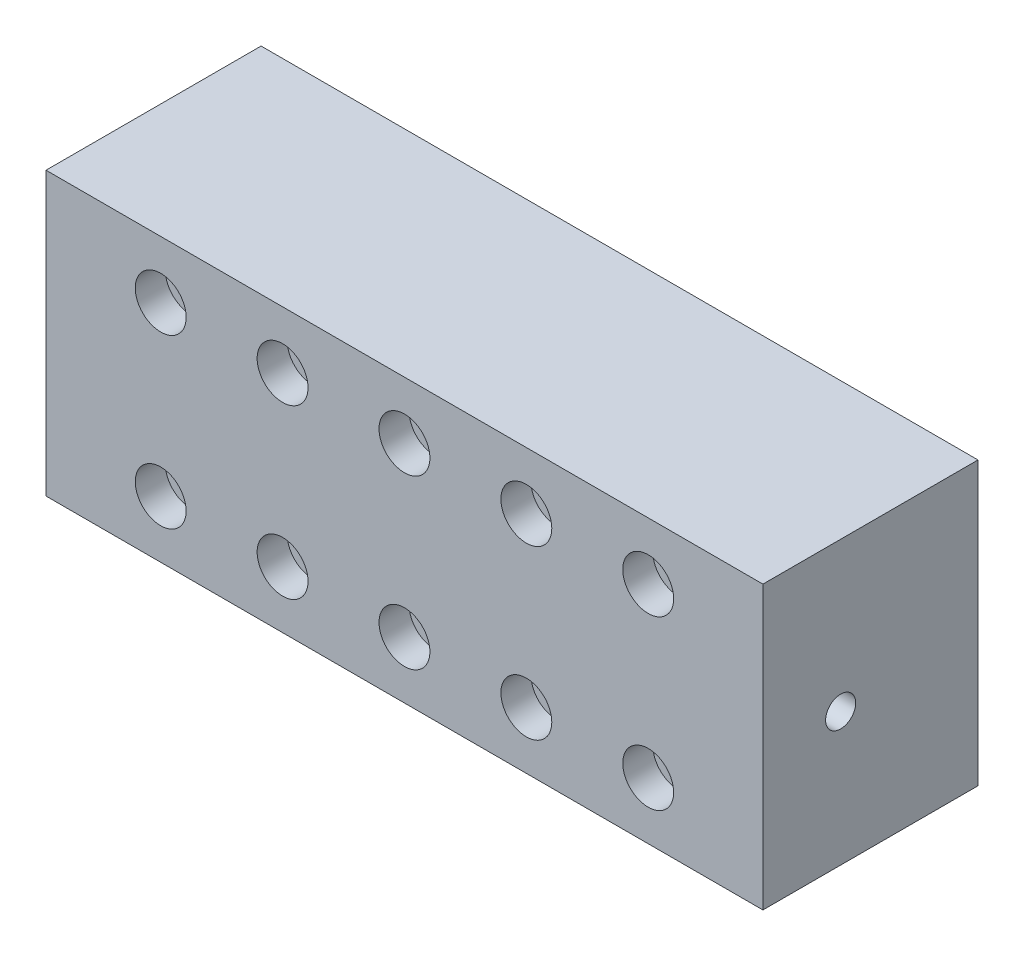
from build123d import *

# Parameters (mm, degrees)
SKIZZE2_W                            = 100
SKIZZE2_H                            = 39.364160046
AUFSATZ_LINEAR_AUSTRAGEN1_DEPTH      = 30
SCHNITT_LINEAR_AUSTRAGEN1_DEPTH      = 40
SCHNITT_LINEAR_AUSTRAGEN1_DEPTH_BACK = 40
SKIZZE10_R                           = 5
SKIZZE17_R                           = 1.55
SCHNITT_LINEAR_AUSTRAGEN2_DEPTH      = 9.1
SKIZZE24_R                           = 2
SCHNITT_LINEAR_AUSTRAGEN4_DEPTH      = 112.577493681
SKIZZE41_R                           = 3.55
SCHNITT_LINEAR_AUSTRAGEN11_DEPTH     = 4.2
LINEARES_MUSTER5_COUNT               = 5
LINEARES_MUSTER5_PITCH               = 17
SPIEGELN9_COPY_1_SKETCH_R            = 3.55
SPIEGELN9_COPY_1_DEPTH               = 4.2
SPIEGELN9_COPY_2_SKETCH_R            = 3.55
SPIEGELN9_COPY_2_DEPTH               = 4.2
SPIEGELN9_COPY_3_SKETCH_R            = 3.55
SPIEGELN9_COPY_3_DEPTH               = 4.2
SPIEGELN9_COPY_4_SKETCH_R            = 3.55
SPIEGELN9_COPY_4_DEPTH               = 4.2
SPIEGELN9_COPY_5_SKETCH_R            = 3.55
SPIEGELN9_COPY_5_DEPTH               = 4.2
SKIZZE28_W                           = 7.1
SKIZZE28_H                           = 3.3
SCHNITT_LINEAR_AUSTRAGEN5_DEPTH      = 7.96
SCHNITT_LINEAR_AUSTRAGEN8_DEPTH      = 1.65
LINEARES_MUSTER3_COUNT               = 5
LINEARES_MUSTER3_PITCH               = 17
LINEARES_MUSTER4_COUNT               = 5
LINEARES_MUSTER4_PITCH               = 17
SPIEGELN7_COPY_1_DEPTH               = 1.65
SPIEGELN7_COPY_2_DEPTH               = 1.65
SPIEGELN7_COPY_3_DEPTH               = 1.65
SPIEGELN7_COPY_4_DEPTH               = 1.65
SPIEGELN7_COPY_5_DEPTH               = 1.65
SPIEGELN8_COPY_1_SKETCH_W            = 7.1
SPIEGELN8_COPY_1_SKETCH_H            = 3.3
SPIEGELN8_COPY_1_DEPTH               = 7.96
SPIEGELN8_COPY_2_SKETCH_W            = 7.1
SPIEGELN8_COPY_2_SKETCH_H            = 3.3
SPIEGELN8_COPY_2_DEPTH               = 7.96
SPIEGELN8_COPY_3_SKETCH_W            = 7.1
SPIEGELN8_COPY_3_SKETCH_H            = 3.3
SPIEGELN8_COPY_3_DEPTH               = 7.96
SPIEGELN8_COPY_4_SKETCH_W            = 7.1
SPIEGELN8_COPY_4_SKETCH_H            = 3.3
SPIEGELN8_COPY_4_DEPTH               = 7.96
SPIEGELN8_COPY_5_SKETCH_W            = 7.1
SPIEGELN8_COPY_5_SKETCH_H            = 3.3
SPIEGELN8_COPY_5_DEPTH               = 7.96
SKIZZE37_R                           = 0.5
SCHNITT_LINEAR_AUSTRAGEN9_DEPTH      = 112.577493681
SKIZZE40_R                           = 2.1
SCHNITT_LINEAR_AUSTRAGEN10_DEPTH     = 6


with BuildPart() as part:
    # Skizze2 → Aufsatz-Linear austragen1 (new body)
    with BuildSketch(Plane.XY):
        with Locations((50, 19.682080023)):
            Rectangle(SKIZZE2_W, SKIZZE2_H)
    extrude(amount=AUFSATZ_LINEAR_AUSTRAGEN1_DEPTH)

    # Skizze10 → Schnitt-Linear austragen1 (cut, two sides: drawn at the far end of the back side and taken through both)
    with BuildSketch(Plane.ZY.offset(-50).offset(-SCHNITT_LINEAR_AUSTRAGEN1_DEPTH_BACK)):
        with Locations((14.945770016, 20.027045739)):
            Circle(SKIZZE10_R)
    extrude(amount=SCHNITT_LINEAR_AUSTRAGEN1_DEPTH + SCHNITT_LINEAR_AUSTRAGEN1_DEPTH_BACK, mode=Mode.SUBTRACT)

    # Skizze17 → Schnitt-Linear austragen2 (cut)
    with BuildSketch(Plane.ZY.offset(-90)):
        with Locations((14.945770016, 20.027045739)):
            Circle(SKIZZE17_R)
    schnitt_linear_austragen2 = extrude(amount=-SCHNITT_LINEAR_AUSTRAGEN2_DEPTH, mode=Mode.SUBTRACT)

    # Spiegeln1: Schnitt-Linear austragen2 across plane
    add(schnitt_linear_austragen2.mirror(Plane.ZY.offset(-50)), mode=Mode.SUBTRACT)

    # Skizze24 → Schnitt-Linear austragen4 (cut, through all)
    with BuildSketch(Plane.XY.offset(30)):
        with Locations((16, 31.364160046)):
            Circle(SKIZZE24_R)
        with Locations((33, 31.364160046)):
            Circle(SKIZZE24_R)
        with Locations((50, 31.364160046)):
            Circle(SKIZZE24_R)
        with Locations((67, 31.364160046)):
            Circle(SKIZZE24_R)
        with Locations((84, 31.364160046)):
            Circle(SKIZZE24_R)
    schnitt_linear_austragen4 = extrude(amount=-SCHNITT_LINEAR_AUSTRAGEN4_DEPTH, mode=Mode.SUBTRACT)

    # Spiegeln4: Schnitt-Linear austragen4 across plane
    add(schnitt_linear_austragen4.mirror(Plane.ZX.offset(19.664160046)), mode=Mode.SUBTRACT)

    # Skizze41 → Schnitt-Linear austragen11 (cut)
    with BuildSketch(Plane.XY.offset(30)):
        with Locations((16, 31.364160046)):
            Circle(SKIZZE41_R)
    schnitt_linear_austragen11 = extrude(amount=-SCHNITT_LINEAR_AUSTRAGEN11_DEPTH, mode=Mode.SUBTRACT)

    # Lineares Muster5: Schnitt-Linear austragen11 ×5
    with Locations(*[(i * LINEARES_MUSTER5_PITCH, 0, 0) for i in range(1, LINEARES_MUSTER5_COUNT)]):
        add(schnitt_linear_austragen11, mode=Mode.SUBTRACT)

    # Spiegeln9 copy 1 sketch → Spiegeln9 copy 1 (cut)
    with BuildSketch(Plane(origin=(17, 39.328320093, 30), x_dir=(1, 0, 0), z_dir=(0, 0, 1))):
        with Locations((16, -31.364160046)):
            Circle(SPIEGELN9_COPY_1_SKETCH_R)
    extrude(amount=-SPIEGELN9_COPY_1_DEPTH, mode=Mode.SUBTRACT)

    # Spiegeln9 copy 2 sketch → Spiegeln9 copy 2 (cut)
    with BuildSketch(Plane(origin=(34, 39.328320093, 30), x_dir=(1, 0, 0), z_dir=(0, 0, 1))):
        with Locations((16, -31.364160046)):
            Circle(SPIEGELN9_COPY_2_SKETCH_R)
    extrude(amount=-SPIEGELN9_COPY_2_DEPTH, mode=Mode.SUBTRACT)

    # Spiegeln9 copy 3 sketch → Spiegeln9 copy 3 (cut)
    with BuildSketch(Plane(origin=(51, 39.328320093, 30), x_dir=(1, 0, 0), z_dir=(0, 0, 1))):
        with Locations((16, -31.364160046)):
            Circle(SPIEGELN9_COPY_3_SKETCH_R)
    extrude(amount=-SPIEGELN9_COPY_3_DEPTH, mode=Mode.SUBTRACT)

    # Spiegeln9 copy 4 sketch → Spiegeln9 copy 4 (cut)
    with BuildSketch(Plane(origin=(68, 39.328320093, 30), x_dir=(1, 0, 0), z_dir=(0, 0, 1))):
        with Locations((16, -31.364160046)):
            Circle(SPIEGELN9_COPY_4_SKETCH_R)
    extrude(amount=-SPIEGELN9_COPY_4_DEPTH, mode=Mode.SUBTRACT)

    # Spiegeln9 copy 5 sketch → Spiegeln9 copy 5 (cut)
    with BuildSketch(Plane(origin=(0, 39.328320093, 30), x_dir=(1, 0, 0), z_dir=(0, 0, 1))):
        with Locations((16, -31.364160046)):
            Circle(SPIEGELN9_COPY_5_SKETCH_R)
    extrude(amount=-SPIEGELN9_COPY_5_DEPTH, mode=Mode.SUBTRACT)

    # Skizze28 → Schnitt-Linear austragen5 (cut)
    with BuildSketch(Plane(origin=(0, 0, 0), x_dir=(-1, 0, 0), z_dir=(0, -1, 0))):
        with Locations((-16, -8.415336397)):
            Rectangle(SKIZZE28_W, SKIZZE28_H)
    schnitt_linear_austragen5 = extrude(amount=-SCHNITT_LINEAR_AUSTRAGEN5_DEPTH, mode=Mode.SUBTRACT)

    # Skizze34 → Schnitt-Linear austragen8 (cut, symmetric)
    with BuildSketch(Plane(origin=(0, 0, 8.4), x_dir=(-1, 0, 0), z_dir=(0, 0, -1))):
        Polygon((-16, 12.005611931), (-19.5, 9.984885989), (-19.5, 5.943434104), (-16, 3.922708162), (-12.5, 5.943434104), (-12.5, 9.984885989), align=None)
    schnitt_linear_austragen8 = extrude(amount=SCHNITT_LINEAR_AUSTRAGEN8_DEPTH, both=True, mode=Mode.SUBTRACT)

    # Lineares Muster3: Schnitt-Linear austragen8 ×5
    with Locations(*[(i * LINEARES_MUSTER3_PITCH, 0, 0) for i in range(1, LINEARES_MUSTER3_COUNT)]):
        add(schnitt_linear_austragen8, mode=Mode.SUBTRACT)

    # Lineares Muster4: Schnitt-Linear austragen5 ×5
    with Locations(*[(i * LINEARES_MUSTER4_PITCH, 0, 0) for i in range(1, LINEARES_MUSTER4_COUNT)]):
        add(schnitt_linear_austragen5, mode=Mode.SUBTRACT)

    # Spiegeln6: Schnitt-Linear austragen8 across plane
    add(schnitt_linear_austragen8.mirror(Plane.ZX.offset(19.664160046)), mode=Mode.SUBTRACT)

    # Spiegeln7 copy 1 sketch → Spiegeln7 copy 1 (cut, symmetric)
    with BuildSketch(Plane(origin=(17, 39.328320093, 8.4), x_dir=(-1, 0, 0), z_dir=(0, 0, -1))):
        Polygon((-16, -12.005611931), (-19.5, -9.984885989), (-19.5, -5.943434104), (-16, -3.922708162), (-12.5, -5.943434104), (-12.5, -9.984885989), align=None)
    extrude(amount=SPIEGELN7_COPY_1_DEPTH, both=True, mode=Mode.SUBTRACT)

    # Spiegeln7 copy 2 sketch → Spiegeln7 copy 2 (cut, symmetric)
    with BuildSketch(Plane(origin=(34, 39.328320093, 8.4), x_dir=(-1, 0, 0), z_dir=(0, 0, -1))):
        Polygon((-16, -12.005611931), (-19.5, -9.984885989), (-19.5, -5.943434104), (-16, -3.922708162), (-12.5, -5.943434104), (-12.5, -9.984885989), align=None)
    extrude(amount=SPIEGELN7_COPY_2_DEPTH, both=True, mode=Mode.SUBTRACT)

    # Spiegeln7 copy 3 sketch → Spiegeln7 copy 3 (cut, symmetric)
    with BuildSketch(Plane(origin=(51, 39.328320093, 8.4), x_dir=(-1, 0, 0), z_dir=(0, 0, -1))):
        Polygon((-16, -12.005611931), (-19.5, -9.984885989), (-19.5, -5.943434104), (-16, -3.922708162), (-12.5, -5.943434104), (-12.5, -9.984885989), align=None)
    extrude(amount=SPIEGELN7_COPY_3_DEPTH, both=True, mode=Mode.SUBTRACT)

    # Spiegeln7 copy 4 sketch → Spiegeln7 copy 4 (cut, symmetric)
    with BuildSketch(Plane(origin=(68, 39.328320093, 8.4), x_dir=(-1, 0, 0), z_dir=(0, 0, -1))):
        Polygon((-16, -12.005611931), (-19.5, -9.984885989), (-19.5, -5.943434104), (-16, -3.922708162), (-12.5, -5.943434104), (-12.5, -9.984885989), align=None)
    extrude(amount=SPIEGELN7_COPY_4_DEPTH, both=True, mode=Mode.SUBTRACT)

    # Spiegeln7 copy 5 sketch → Spiegeln7 copy 5 (cut, symmetric)
    with BuildSketch(Plane(origin=(0, 39.328320093, 8.4), x_dir=(-1, 0, 0), z_dir=(0, 0, -1))):
        Polygon((-16, -12.005611931), (-19.5, -9.984885989), (-19.5, -5.943434104), (-16, -3.922708162), (-12.5, -5.943434104), (-12.5, -9.984885989), align=None)
    extrude(amount=SPIEGELN7_COPY_5_DEPTH, both=True, mode=Mode.SUBTRACT)

    # Spiegeln8 copy 1 sketch → Spiegeln8 copy 1 (cut)
    with BuildSketch(Plane(origin=(17, 39.328320093, 0), x_dir=(-1, 0, 0), z_dir=(0, 1, 0))):
        with Locations((-16, 8.415336397)):
            Rectangle(SPIEGELN8_COPY_1_SKETCH_W, SPIEGELN8_COPY_1_SKETCH_H)
    extrude(amount=-SPIEGELN8_COPY_1_DEPTH, mode=Mode.SUBTRACT)

    # Spiegeln8 copy 2 sketch → Spiegeln8 copy 2 (cut)
    with BuildSketch(Plane(origin=(34, 39.328320093, 0), x_dir=(-1, 0, 0), z_dir=(0, 1, 0))):
        with Locations((-16, 8.415336397)):
            Rectangle(SPIEGELN8_COPY_2_SKETCH_W, SPIEGELN8_COPY_2_SKETCH_H)
    extrude(amount=-SPIEGELN8_COPY_2_DEPTH, mode=Mode.SUBTRACT)

    # Spiegeln8 copy 3 sketch → Spiegeln8 copy 3 (cut)
    with BuildSketch(Plane(origin=(51, 39.328320093, 0), x_dir=(-1, 0, 0), z_dir=(0, 1, 0))):
        with Locations((-16, 8.415336397)):
            Rectangle(SPIEGELN8_COPY_3_SKETCH_W, SPIEGELN8_COPY_3_SKETCH_H)
    extrude(amount=-SPIEGELN8_COPY_3_DEPTH, mode=Mode.SUBTRACT)

    # Spiegeln8 copy 4 sketch → Spiegeln8 copy 4 (cut)
    with BuildSketch(Plane(origin=(68, 39.328320093, 0), x_dir=(-1, 0, 0), z_dir=(0, 1, 0))):
        with Locations((-16, 8.415336397)):
            Rectangle(SPIEGELN8_COPY_4_SKETCH_W, SPIEGELN8_COPY_4_SKETCH_H)
    extrude(amount=-SPIEGELN8_COPY_4_DEPTH, mode=Mode.SUBTRACT)

    # Spiegeln8 copy 5 sketch → Spiegeln8 copy 5 (cut)
    with BuildSketch(Plane(origin=(0, 39.328320093, 0), x_dir=(-1, 0, 0), z_dir=(0, 1, 0))):
        with Locations((-16, 8.415336397)):
            Rectangle(SPIEGELN8_COPY_5_SKETCH_W, SPIEGELN8_COPY_5_SKETCH_H)
    extrude(amount=-SPIEGELN8_COPY_5_DEPTH, mode=Mode.SUBTRACT)

    # Skizze37 → Schnitt-Linear austragen9 (cut, through all)
    with BuildSketch(Plane(origin=(100, 0, 0), x_dir=(0, 0, -1), z_dir=(1, 0, 0))):
        with Locations((-19.158756707, 18.550923217)):
            Circle(SKIZZE37_R)
    extrude(amount=-SCHNITT_LINEAR_AUSTRAGEN9_DEPTH, mode=Mode.SUBTRACT)

    # Skizze40 → Schnitt-Linear austragen10 (cut)
    with BuildSketch(Plane(origin=(100, 0, 0), x_dir=(0, 0, -1), z_dir=(1, 0, 0))):
        with Locations((-19.158756707, 18.550923217)):
            Circle(SKIZZE40_R)
    extrude(amount=-SCHNITT_LINEAR_AUSTRAGEN10_DEPTH, mode=Mode.SUBTRACT)


solid = part.part
